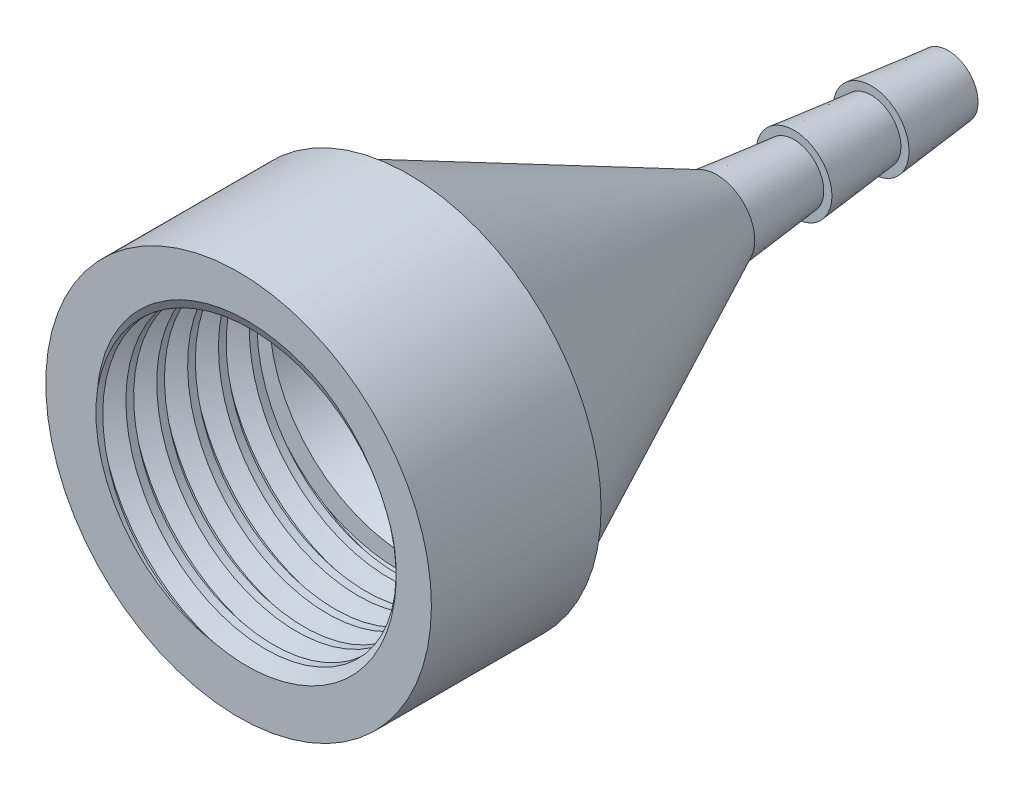
from build123d import *

# Parameters (mm, degrees)
SKETCH1_R           = 12.5
SKETCH1_R_2         = 9.25
BOSS_EXTRUDE1_DEPTH = 11
THREAD1_PITCH       = 2
SKETCH6_R           = 12
BOSS_EXTRUDE2_DEPTH = 20
BOSS_EXTRUDE2_DRAFT = -25.5
SKETCH13_R          = 9
CUT_EXTRUDE1_DEPTH  = 20
CUT_EXTRUDE1_TAPER  = 21.5
SKETCH18_R          = 2.46
BOSS_EXTRUDE3_DEPTH = 5
BOSS_EXTRUDE3_TAPER = 6
LPATTERN1_COUNT     = 3
LPATTERN1_PITCH     = 5
SKETCH20_R          = 1
CUT_EXTRUDE2_DEPTH  = 50.279813455
FILLET1_R           = 10


with BuildPart() as part:
    # Sketch1 → Boss-Extrude1 (new body)
    with BuildSketch(Plane.XY):
        Circle(SKETCH1_R)
        Circle(SKETCH1_R_2, mode=Mode.SUBTRACT)
    extrude(amount=BOSS_EXTRUDE1_DEPTH)

    # Thread1: the profile of Thread Profile1 profile screwed along a right-hand helix of 6.275 turns, 10 arcs to a turn; built about Z, then put on its axis
    thread1_z = Axis((0, 0, 0), (0, 0, 1))
    thread1_corners = [(9.2497, 0, -0.000173205), (10.33253175, 0, 0.624999997), (10.33253175, 0, 0.874999997), (9.2497, 0, 1.5001732)]
    with BuildLine(mode=Mode.PRIVATE) as thread1_profile:
        Line(thread1_corners[0], thread1_corners[1])
        Line(thread1_corners[1], thread1_corners[2])
        Line(thread1_corners[2], thread1_corners[3])
        Line(thread1_corners[3], thread1_corners[0])
    thread1_cap = Face(thread1_profile.wire())
    thread1_turn_angles = [0, 18, 36, 54, 72, 90, 108, 126, 144, 162, 180, 198, 216, 234, 252, 270, 288, 306, 324, 342, 360]
    thread1_turn_weights = [1, 0.9510565162951535, 1, 0.9510565162951535, 1, 0.9510565162951535, 1, 0.9510565162951535, 1, 0.9510565162951535, 1, 0.9510565162951535, 1, 0.9510565162951535, 1, 0.9510565162951535, 1, 0.9510565162951535, 1, 0.9510565162951535, 1]
    thread1_turn_rails = [Edge.make_bspline([Vector(p[0], p[1], 0).rotate(thread1_z, thread1_turn_angles[k]) / thread1_turn_weights[k] + Vector(0, 0, p[2] + THREAD1_PITCH * thread1_turn_angles[k] / 360) for k in range(21)], [0, 0, 0, 1, 1, 2, 2, 3, 3, 4, 4, 5, 5, 6, 6, 7, 7, 8, 8, 9, 9, 10, 10, 10], 2, thread1_turn_weights) for p in thread1_corners]
    thread1_turn_sides = [Face.make_surface_from_curves(thread1_turn_rails[p[0]], thread1_turn_rails[p[1]]) for p in [(0, 1), (1, 2), (2, 3), (3, 0)]]
    thread1_last_angles = [2160, 2178, 2196, 2214, 2232, 2245.5, 2259]
    thread1_last_weights = [1, 0.9510565162951535, 1, 0.9510565162951535, 1, 0.9723699203976766, 1]
    thread1_last_rails = [Edge.make_bspline([Vector(p[0], p[1], 0).rotate(thread1_z, thread1_last_angles[k]) / thread1_last_weights[k] + Vector(0, 0, p[2] + THREAD1_PITCH * thread1_last_angles[k] / 360) for k in range(7)], [0, 0, 0, 1, 1, 2, 2, 3, 3, 3], 2, thread1_last_weights) for p in thread1_corners]
    thread1_last_sides = [Face.make_surface_from_curves(thread1_last_rails[p[0]], thread1_last_rails[p[1]]) for p in [(0, 1), (1, 2), (2, 3), (3, 0)]]
    thread1 = Plane(origin=(0, 0, 12.55), x_dir=(-1, 0, 0), z_dir=(0, 0, -1)) * Solid(Shell([*[p.moved(Location((0, 0, THREAD1_PITCH * i))) for i in range(6) for p in thread1_turn_sides], *thread1_last_sides, thread1_cap, thread1_cap.rotate(thread1_z, 2259).moved(Location((0, 0, THREAD1_PITCH * 2259 / 360)))]))
    add(thread1, mode=Mode.SUBTRACT)


with BuildPart() as body_2:
    # Sketch6 → Boss-Extrude2 (with draft: the straight prism first)
    with BuildSketch(Plane.XY):
        Circle(SKETCH6_R)
    extrude(amount=-BOSS_EXTRUDE2_DEPTH)
    # Boss-Extrude2: the draft: its side faces are tilted about the plane it starts from
    boss_extrude2_sides = [body_2.faces().sort_by_distance(p)[0] for p in [
        (-12, 0, -10),
    ]]
    draft(boss_extrude2_sides, Plane.XY, BOSS_EXTRUDE2_DRAFT)

    # Sketch13 → Cut-Extrude1 (cut)
    with BuildSketch(Plane(origin=(0, 0, 0), x_dir=(-1, 0, 0), z_dir=(0, 0, -1))):
        Circle(SKETCH13_R)
    extrude(amount=CUT_EXTRUDE1_DEPTH, taper=CUT_EXTRUDE1_TAPER, mode=Mode.SUBTRACT)

    # Sketch18 → Boss-Extrude3 (add)
    with BuildSketch(Plane(origin=(0, 0, -20), x_dir=(-1, 0, 0), z_dir=(0, 0, -1))):
        Circle(SKETCH18_R)
    boss_extrude3 = extrude(amount=BOSS_EXTRUDE3_DEPTH, taper=BOSS_EXTRUDE3_TAPER)

    # LPattern1: Boss-Extrude3 ×3
    with Locations(*[(0, 0, -i * LPATTERN1_PITCH) for i in range(1, LPATTERN1_COUNT)]):
        add(boss_extrude3)

    # Sketch20 → Cut-Extrude2 (cut, through all)
    with BuildSketch(Plane(origin=(0, 0, -35), x_dir=(-1, 0, 0), z_dir=(0, 0, -1))):
        Circle(SKETCH20_R)
    extrude(amount=-CUT_EXTRUDE2_DEPTH, mode=Mode.SUBTRACT)

    # Fillet1
    # the kernel refuses this fillet: 10 mm, written as the material it takes off along each edge
    with BuildSketch(Plane(origin=(0, 0, -20), x_dir=(-1, 0, 0), z_dir=(0, -1, 0))) as fillet1_piece_1:
        with BuildLine():
            CenterArc((11, 1.555948852), FILLET1_R, 180, 8.951299266)
            Line((1.121790488, 0), (1, 0))
            Line((1, 0), (1, 1.555948852))
        make_face()
    revolve(axis=Axis((0, 0, -20), (0, 0, -1)), mode=Mode.SUBTRACT)


solid = Compound([part.part, body_2.part])
